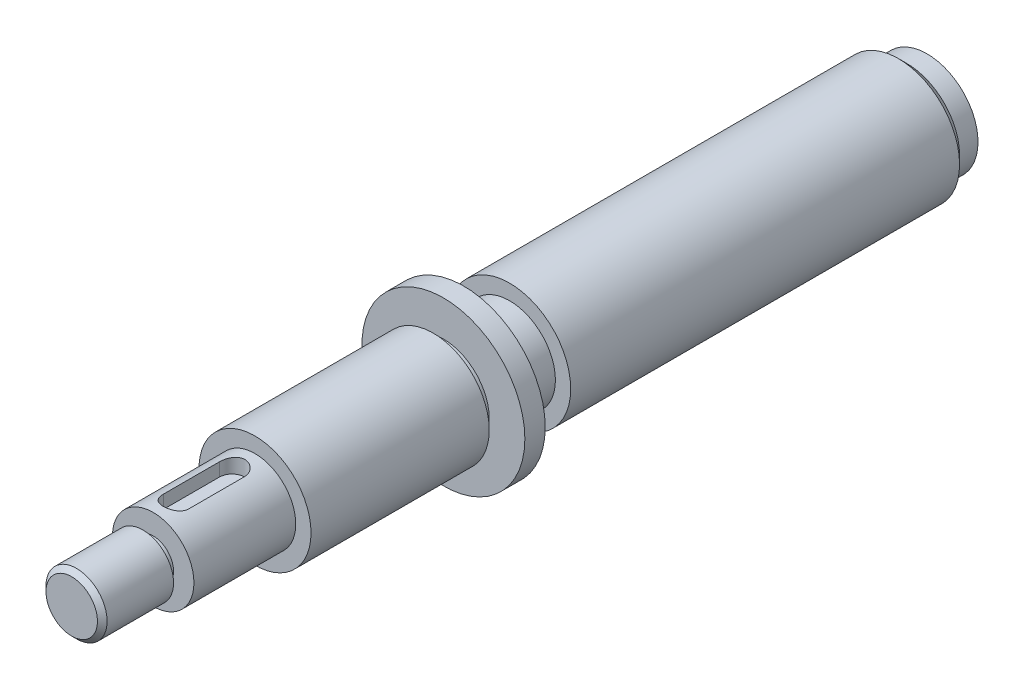
from build123d import *

# Parameters (mm, degrees)
SKETCH_1_R          = 10
EXTRUDE_1_DEPTH     = 4
SKETCH_2_R          = 12
EXTRUDE_2_DEPTH     = 78
SKETCH_4_R          = 9
EXTRUDE_3_DEPTH     = 15
EXTRUDE_START       = -2
SKETCH_5_R          = 16
EXTRUDE_4_DEPTH     = 4
SKETCH_6_R          = 11
EXTRUDE_5_DEPTH     = 35
SKETCH_7_R          = 8
EXTRUDE_6_DEPTH     = 20
SKETCH_8_R          = 6
EXTRUDE_7_DEPTH     = 16
CUT_EXTRUDE_START   = 20
SKETCH_9_R          = 6
SKETCH_9_R_2        = 4
CUT_EXTRUDE_1_DEPTH = 2
CUT_EXTRUDE_START_2 = 8
CUT_EXTRUDE_2_DEPTH = 3


# Read off the part's stored shape, not the designer's step: M24 机械螺纹 螺柱1, M12 机械螺纹 螺柱1
with BuildPart() as part:
    # 草图1 → 凸台-拉伸1 (new body)
    with BuildSketch(Plane.XY):
        Circle(SKETCH_1_R)
    extrude(amount=EXTRUDE_1_DEPTH)

    # 草图2 → 凸台-拉伸2 (add)
    with BuildSketch(Plane.XY.offset(4)):
        Circle(SKETCH_2_R)
    extrude(amount=EXTRUDE_2_DEPTH)

    # M24 机械螺纹 螺柱1 outline → M24 机械螺纹 螺柱1 (revolve, cut)
    with BuildSketch(Plane.XZ):
        Polygon((12, 5.624), (10.376, 4), (12, 4), align=None)
    revolve(axis=Axis((0, 0, 0), (0, 0, 1)), mode=Mode.SUBTRACT)

    # 草图4 → 凸台-拉伸3 (add)
    with BuildSketch(Plane.XY.offset(82)):
        Circle(SKETCH_4_R)
    extrude(amount=EXTRUDE_3_DEPTH)

    # 草图5 → 凸台-拉伸4 (add)
    with BuildSketch(Plane.XY.offset(97).offset(EXTRUDE_START)):
        Circle(SKETCH_5_R)
    extrude(amount=-EXTRUDE_4_DEPTH)

    # 草图6 → 凸台-拉伸5 (add)
    with BuildSketch(Plane.XY.offset(97)):
        Circle(SKETCH_6_R)
    extrude(amount=EXTRUDE_5_DEPTH)

    # 草图7 → 凸台-拉伸6 (add)
    with BuildSketch(Plane.XY.offset(132)):
        Circle(SKETCH_7_R)
    extrude(amount=EXTRUDE_6_DEPTH)

    # 草图8 → 凸台-拉伸7 (add)
    with BuildSketch(Plane.XY.offset(152)):
        Circle(SKETCH_8_R)
    extrude(amount=EXTRUDE_7_DEPTH)

    # 草图9 → 切除-拉伸1 (cut)
    with BuildSketch(Plane.XY.offset(132).offset(CUT_EXTRUDE_START)):
        Circle(SKETCH_9_R)
        Circle(SKETCH_9_R_2, mode=Mode.SUBTRACT)
    extrude(amount=CUT_EXTRUDE_1_DEPTH, mode=Mode.SUBTRACT)

    # M12 机械螺纹 螺柱1 outline → M12 机械螺纹 螺柱1 (revolve, cut)
    with BuildSketch(Plane.XZ):
        Polygon((6, 168), (5.053, 168), (6, 167.053), align=None)
    revolve(axis=Axis((0, 0, 0), (0, 0, 1)), mode=Mode.SUBTRACT)

    # 草图11 → 切除-拉伸2 (cut)
    with BuildSketch(Plane(origin=(0, 0, 0), x_dir=(1, 0, 0), z_dir=(0, 1, 0)).offset(CUT_EXTRUDE_START_2)):
        with BuildLine():
            Line((-2.5, -147.5), (-2.5, -136.5))
            ThreePointArc((-2.5, -136.5), (0, -134), (2.5, -136.5))
            Line((2.5, -136.5), (2.5, -147.5))
            ThreePointArc((2.5, -147.5), (0, -150), (-2.5, -147.5))
        make_face()
    extrude(amount=-CUT_EXTRUDE_2_DEPTH, mode=Mode.SUBTRACT)


solid = part.part
